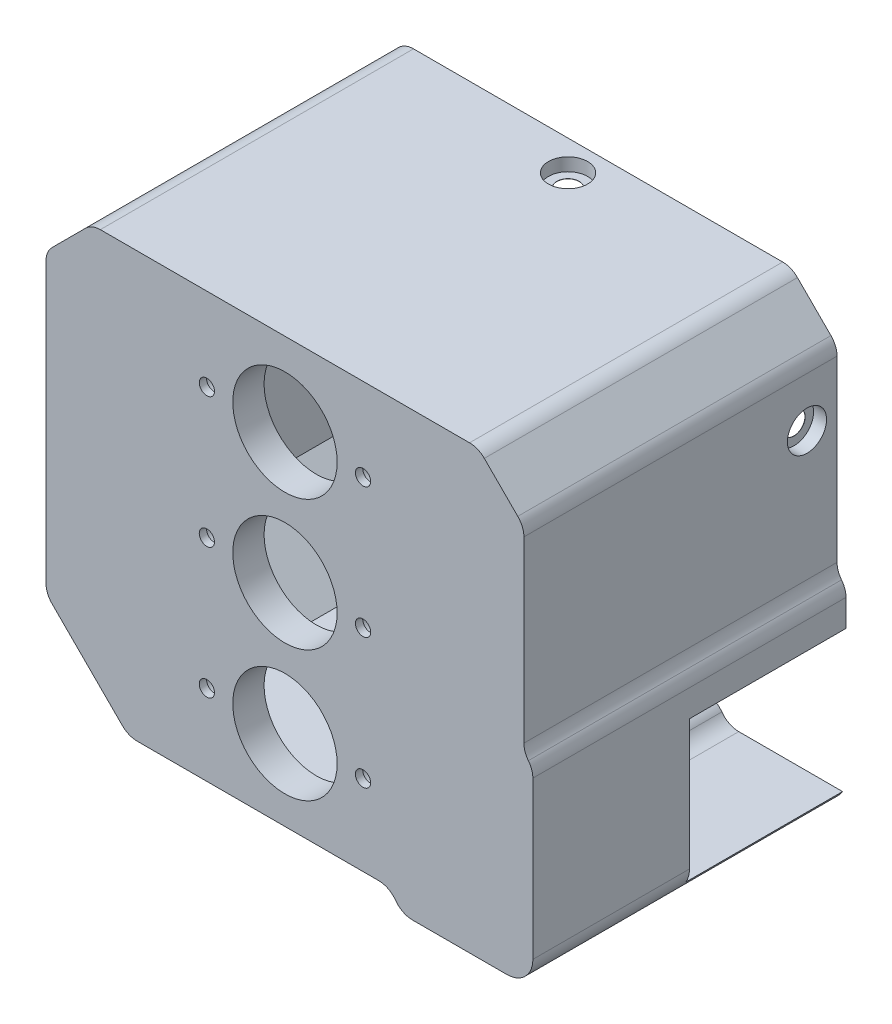
from build123d import *

# Parameters (mm, degrees)
BOSS_EXTRUDE1_DEPTH                             = 38.1
SHELL1_T                                        = -1.6002
BOSS_EXTRUDE2_START                             = 2.2098
BOSS_EXTRUDE2_DEPTH                             = 3.81
FILLET1_R                                       = 2.54
FILLET2_R                                       = 2.54
CUT_EXTRUDE1_REACH                              = 78.617
SKETCH4_W                                       = 19.05
SKETCH4_H                                       = 17.399
CBORE_FOR_2_PAN_HEAD_MACHINE_SCREW1_D           = 2.7051
CBORE_FOR_2_PAN_HEAD_MACHINE_SCREW1_DEPTH       = 1.6002
CBORE_FOR_2_PAN_HEAD_MACHINE_SCREW1_CBORE_D     = 4.7625
CBORE_FOR_2_PAN_HEAD_MACHINE_SCREW1_CBORE_DEPTH = 1.5748
CBORE_FOR_2_PAN_HEAD_MACHINE_SCREW2_D           = 2.7051
CBORE_FOR_2_PAN_HEAD_MACHINE_SCREW2_DEPTH       = 1.6002
CBORE_FOR_2_PAN_HEAD_MACHINE_SCREW2_CBORE_D     = 4.7625
CBORE_FOR_2_PAN_HEAD_MACHINE_SCREW2_CBORE_DEPTH = 1.5748
CBORE_FOR_2_PAN_HEAD_MACHINE_SCREW3_D           = 2.7051
CBORE_FOR_2_PAN_HEAD_MACHINE_SCREW3_DEPTH       = 1.6002
CBORE_FOR_2_PAN_HEAD_MACHINE_SCREW3_CBORE_D     = 4.7625
CBORE_FOR_2_PAN_HEAD_MACHINE_SCREW3_CBORE_DEPTH = 1.5748
CBORE_FOR_2_PAN_HEAD_MACHINE_SCREW4_D           = 2.7051
CBORE_FOR_2_PAN_HEAD_MACHINE_SCREW4_CBORE_D     = 4.7625
CBORE_FOR_2_PAN_HEAD_MACHINE_SCREW4_CBORE_DEPTH = 1.5748
HOLE1_AT_2_COUNT                                = 2
HOLE1_AT_2_PITCH                                = 19
HOLE1_AT_3_COUNT                                = 2
HOLE1_AT_3_PITCH                                = 24.759152348
HOLE1_AT_4_COUNT                                = 2
HOLE1_AT_4_PITCH                                = 15.875
HOLE1_AT_5_COUNT                                = 2
HOLE1_AT_5_PITCH                                = 31.75
HOLE1_AT_6_COUNT                                = 2
HOLE1_AT_6_PITCH                                = 37.000844585
F_0_CLEARANCE_HOLE1_D                           = 1.8542
CUT_EXTRUDE2_REACH                              = 59.194
SKETCH27_R                                      = 6.35


with BuildPart() as part:
    # Sketch1 → Boss-Extrude1 (new body)
    with BuildSketch(Plane.XY):
        with BuildLine():
            Line((-19.03965798, -28.067), (-29.07265798, -18.034))
            Line((-29.07265798, -18.034), (-29.07265798, 18.034))
            Line((-29.07265798, 18.034), (-23.513075374, 23.593582606))
            Line((-23.513075374, 23.593582606), (23.513075374, 23.593582606))
            Line((23.513075374, 23.593582606), (29.07265798, 18.034))
            Line((29.07265798, 18.034), (29.07265798, -6.832479122))
            Line((29.07265798, -6.832479122), (30.1625, -6.832479122))
            Line((30.1625, -6.832479122), (30.1625, -26.9875))
            ThreePointArc((30.1625, -26.9875), (29.23256403, -29.23256403), (26.9875, -30.1625))
            Line((26.9875, -30.1625), (13.90175798, -30.1625))
            Line((13.90175798, -30.1625), (13.90175798, -28.067))
            Line((13.90175798, -28.067), (-19.03965798, -28.067))
        make_face()
    extrude(amount=BOSS_EXTRUDE1_DEPTH)

    # Shell1
    shell1_openings = [part.faces().sort_by_distance(p)[0] for p in [
        (0.895795901, -2.511562828, 0),
    ]]
    offset(amount=SHELL1_T, openings=shell1_openings, kind=Kind.INTERSECTION)

    # Sketch14 → Boss-Extrude2 (add)
    with BuildSketch(Plane(origin=(0, 0, 36.4998), x_dir=(-1, 0, 0), z_dir=(0, 0, -1)).offset(BOSS_EXTRUDE2_START)):
        with BuildLine():
            Line((27.47245798, 17.371175457), (22.850250832, 21.993382606))
            Line((22.850250832, 21.993382606), (-22.850250832, 21.993382606))
            Line((-22.850250832, 21.993382606), (-27.47245798, 17.371175457))
            Line((-27.47245798, 17.371175457), (-27.47245798, -8.432679122))
            Line((-27.47245798, -8.432679122), (-28.5623, -8.432679122))
            Line((-28.5623, -8.432679122), (-28.5623, -26.9875))
            ThreePointArc((-28.5623, -26.9875), (-28.101051759, -28.101051759), (-26.9875, -28.5623))
            Line((-26.9875, -28.5623), (-15.50195798, -28.5623))
            Line((-15.50195798, -28.5623), (-15.50195798, -26.4668))
            Line((-15.50195798, -26.4668), (18.376833438, -26.4668))
            Line((18.376833438, -26.4668), (27.47245798, -17.371175457))
            Line((27.47245798, -17.371175457), (27.47245798, 17.371175457))
        make_face()
    extrude(amount=-BOSS_EXTRUDE2_DEPTH)

    # Fillet1
    # the kernel refuses this fillet: 2.54 mm, written as the material it adds along each edge
    with BuildSketch(Plane(origin=(13.90175798, -28.067, 0), x_dir=(0, -1, 0), z_dir=(0, 0, 1))) as fillet1_piece_1:
        with BuildLine():
            CenterArc((2.54, -2.500803821), FILLET1_R, 100.078658108, 79.921341892)
            Line((0, -2.500803821), (0, 0))
            Line((0, 0), (2.0955, 0))
        make_face()
    extrude(amount=38.1)
    with BuildSketch(Plane(origin=(28.5623, -8.432679122, 34.29), x_dir=(0, -1, 0), z_dir=(0, 0, -1))) as fillet1_piece_2:
        with BuildLine():
            CenterArc((2.08533974, 2.54), FILLET1_R, 214.814987039, 55.185012961)
            Line((0, 1.08984202), (0, 0))
            Line((0, 0), (2.08533974, 0))
        make_face()
    extrude(amount=34.29)
    with BuildSketch(Plane(origin=(29.07265798, -6.832479122, 0), x_dir=(0, 1, 0), z_dir=(0, 0, 1))) as fillet1_piece_3:
        with BuildLine():
            CenterArc((2.08533974, -2.54), FILLET1_R, 90, 55.185012961)
            Line((0, -1.08984202), (0, 0))
            Line((0, 0), (2.08533974, 0))
        make_face()
    extrude(amount=38.1)
    # the kernel refuses this fillet: 2.54 mm, written as the material it takes off along each edge
    with BuildSketch(Plane(origin=(15.50195798, -26.4668, -6.252009552), x_dir=(-1, 0, 0), z_dir=(0, 0, 1))) as fillet1_2_piece_1:
        with BuildLine():
            CenterArc((2.500803821, 2.54), FILLET1_R, 190.078658108, 79.921341892)
            Line((0, 2.0955), (0, 0))
            Line((0, 0), (2.500803821, 0))
        make_face()
    extrude(amount=40.542009552, mode=Mode.SUBTRACT)
    with BuildSketch(Plane(origin=(-29.07265798, -18.034, -2.630256121), x_dir=(0.7071067811865475, -0.7071067811865475, 0), z_dir=(0, 0, 1)), Plane(origin=(-19.03965798, -28.067, -2.630256121), x_dir=(1, 0, 0), z_dir=(0, 0, 1)), Plane(origin=(29.07265798, 18.034, -2.630256121), x_dir=(-0.7071067811865476, 0.7071067811865476, 0), z_dir=(0, 0, 1)), Plane(origin=(23.513075374, 23.593582606, -2.630256121), x_dir=(-1, 0, 0), z_dir=(0, 0, 1)), Plane(origin=(-23.513075374, 23.593582606, -2.630256121), x_dir=(-0.7071067811865476, -0.7071067811865476, 0), z_dir=(0, 0, 1)), Plane(origin=(-29.07265798, 18.034, -2.630256121), x_dir=(0, -1, 0), z_dir=(0, 0, 1))) as fillet1_2_piece_2:
        with BuildLine():
            CenterArc((FILLET1_R * 0.414213562373, FILLET1_R), FILLET1_R, 225, 45)
            Line((-FILLET1_R * 0.292893218813, FILLET1_R * 0.292893218813), (0, 0))
            Line((0, 0), (FILLET1_R * 0.414213562373, 0))
        make_face()
    extrude(amount=43.360512242, mode=Mode.SUBTRACT)

    # Fillet2
    fillet2_edges = [part.edges().sort_by_distance(p)[0] for p in [
        (30.1625, -6.832479122, 19.05),
        (13.90175798, -30.1625, 19.05),
        (27.47245798, -8.432679122, 17.145),
        (15.50195798, -28.5623, 17.145),
    ]]
    fillet(fillet2_edges, radius=FILLET2_R)

    # Sketch4 → Cut-Extrude1 (cut, up to next)
    with BuildSketch(Plane(origin=(30.1625, 0, 0), x_dir=(0, 0, -1), z_dir=(1, 0, 0)), mode=Mode.PRIVATE) as cut_extrude1_sk1:
        with Locations((-9.525, -19.8628)):
            Rectangle(SKETCH4_W, SKETCH4_H)
    cut_extrude1_tool1 = extrude(cut_extrude1_sk1.sketch, amount=-CUT_EXTRUDE1_REACH, mode=Mode.PRIVATE) & part.part
    add(cut_extrude1_tool1.solids().sort_by_distance((30.1625, -19.8628, 9.525))[0], mode=Mode.SUBTRACT)

    # CBORE for #2 Pan Head Machine Screw1
    with Locations(Plane.ZY.offset(29.07265798)):
        with Locations((3.6565, 0)):
            CounterBoreHole(CBORE_FOR_2_PAN_HEAD_MACHINE_SCREW1_D / 2, CBORE_FOR_2_PAN_HEAD_MACHINE_SCREW1_CBORE_D / 2, CBORE_FOR_2_PAN_HEAD_MACHINE_SCREW1_CBORE_DEPTH, depth=CBORE_FOR_2_PAN_HEAD_MACHINE_SCREW1_DEPTH)

    # CBORE for #2 Pan Head Machine Screw2
    with Locations(Plane(origin=(0, 23.593582606, 0), x_dir=(1, 0, 0), z_dir=(0, 1, 0))):
        with Locations((0, -3.6565)):
            CounterBoreHole(CBORE_FOR_2_PAN_HEAD_MACHINE_SCREW2_D / 2, CBORE_FOR_2_PAN_HEAD_MACHINE_SCREW2_CBORE_D / 2, CBORE_FOR_2_PAN_HEAD_MACHINE_SCREW2_CBORE_DEPTH, depth=CBORE_FOR_2_PAN_HEAD_MACHINE_SCREW2_DEPTH)

    # CBORE for #2 Pan Head Machine Screw3
    with Locations(Plane(origin=(29.07265798, 0, 0), x_dir=(0, 0, -1), z_dir=(1, 0, 0))):
        with Locations((-3.6565, 10.957528192)):
            CounterBoreHole(CBORE_FOR_2_PAN_HEAD_MACHINE_SCREW3_D / 2, CBORE_FOR_2_PAN_HEAD_MACHINE_SCREW3_CBORE_D / 2, CBORE_FOR_2_PAN_HEAD_MACHINE_SCREW3_CBORE_DEPTH, depth=CBORE_FOR_2_PAN_HEAD_MACHINE_SCREW3_DEPTH)

    # CBORE for #2 Pan Head Machine Screw4 (through all)
    with Locations(Plane(origin=(0, -28.067, 0), x_dir=(-1, 0, 0), z_dir=(0, -1, 0))):
        with Locations((0, -3.6565)):
            CounterBoreHole(CBORE_FOR_2_PAN_HEAD_MACHINE_SCREW4_D / 2, CBORE_FOR_2_PAN_HEAD_MACHINE_SCREW4_CBORE_D / 2, CBORE_FOR_2_PAN_HEAD_MACHINE_SCREW4_CBORE_DEPTH)

    # Sketch24 → Hole1 (revolve, cut)
    with BuildSketch(Plane(origin=(9.5, 13.49375, 34.29), x_dir=(0, 1, 0), z_dir=(1, 0, 0))):
        Polygon((0, 0), (0, 2.921), (1.4986, 2.921), (1.6383, 0), align=None)
    hole1 = revolve(axis=Axis((9.5, 13.49375, 144.29), (0, 0, -1)), mode=Mode.SUBTRACT)

    # Hole1 at 2: Hole1 ×2
    with Locations(*[(-i * HOLE1_AT_2_PITCH, 0, 0) for i in range(1, HOLE1_AT_2_COUNT)]):
        add(hole1, mode=Mode.SUBTRACT)

    # Hole1 at 3: Hole1 ×2
    with Locations(*[Vector(-0.7673929920061523, -0.6411770393735614, 0) * (i * HOLE1_AT_3_PITCH) for i in range(1, HOLE1_AT_3_COUNT)]):
        add(hole1, mode=Mode.SUBTRACT)

    # Hole1 at 4: Hole1 ×2
    with Locations(*[(0, -i * HOLE1_AT_4_PITCH, 0) for i in range(1, HOLE1_AT_4_COUNT)]):
        add(hole1, mode=Mode.SUBTRACT)

    # Hole1 at 5: Hole1 ×2
    with Locations(*[(0, -i * HOLE1_AT_5_PITCH, 0) for i in range(1, HOLE1_AT_5_COUNT)]):
        add(hole1, mode=Mode.SUBTRACT)

    # Hole1 at 6: Hole1 ×2
    with Locations(*[Vector(-0.5135017920030289, -0.8580885208471666, 0) * (i * HOLE1_AT_6_PITCH) for i in range(1, HOLE1_AT_6_COUNT)]):
        add(hole1, mode=Mode.SUBTRACT)

    # #0 Clearance Hole1 (through all)
    with Locations(Plane(origin=(0, 0, 34.29), x_dir=(-1, 0, 0), z_dir=(0, 0, -1))):
        with Locations((-9.5, 13.49375), (9.5, 13.49375), (-9.5, -2.38125), (9.5, -2.38125), (-9.5, -18.25625), (9.5, -18.25625)):
            Hole(F_0_CLEARANCE_HOLE1_D / 2)

    # Sketch27 → Cut-Extrude2 (cut, up to next)
    with BuildSketch(Plane.XY.offset(38.1), mode=Mode.PRIVATE) as cut_extrude2_sk1:
        with Locations((0, 13.49375)):
            Circle(SKETCH27_R)
    cut_extrude2_tool1 = extrude(cut_extrude2_sk1.sketch, amount=-CUT_EXTRUDE2_REACH, mode=Mode.PRIVATE) & part.part
    # Sketch27 → Cut-Extrude2 (cut, up to next)
    with BuildSketch(Plane.XY.offset(38.1), mode=Mode.PRIVATE) as cut_extrude2_sk2:
        with Locations((0, -2.38125)):
            Circle(SKETCH27_R)
    cut_extrude2_tool2 = extrude(cut_extrude2_sk2.sketch, amount=-CUT_EXTRUDE2_REACH, mode=Mode.PRIVATE) & part.part
    # Sketch27 → Cut-Extrude2 (cut, up to next)
    with BuildSketch(Plane.XY.offset(38.1), mode=Mode.PRIVATE) as cut_extrude2_sk3:
        with Locations((0, -18.28125)):
            Circle(SKETCH27_R)
    cut_extrude2_tool3 = extrude(cut_extrude2_sk3.sketch, amount=-CUT_EXTRUDE2_REACH, mode=Mode.PRIVATE) & part.part
    add(cut_extrude2_tool1.solids().sort_by_distance((0, 13.49375, 38.1))[0], mode=Mode.SUBTRACT)
    add(cut_extrude2_tool2.solids().sort_by_distance((0, -2.38125, 38.1))[0], mode=Mode.SUBTRACT)
    add(cut_extrude2_tool3.solids().sort_by_distance((0, -18.28125, 38.1))[0], mode=Mode.SUBTRACT)


solid = part.part
